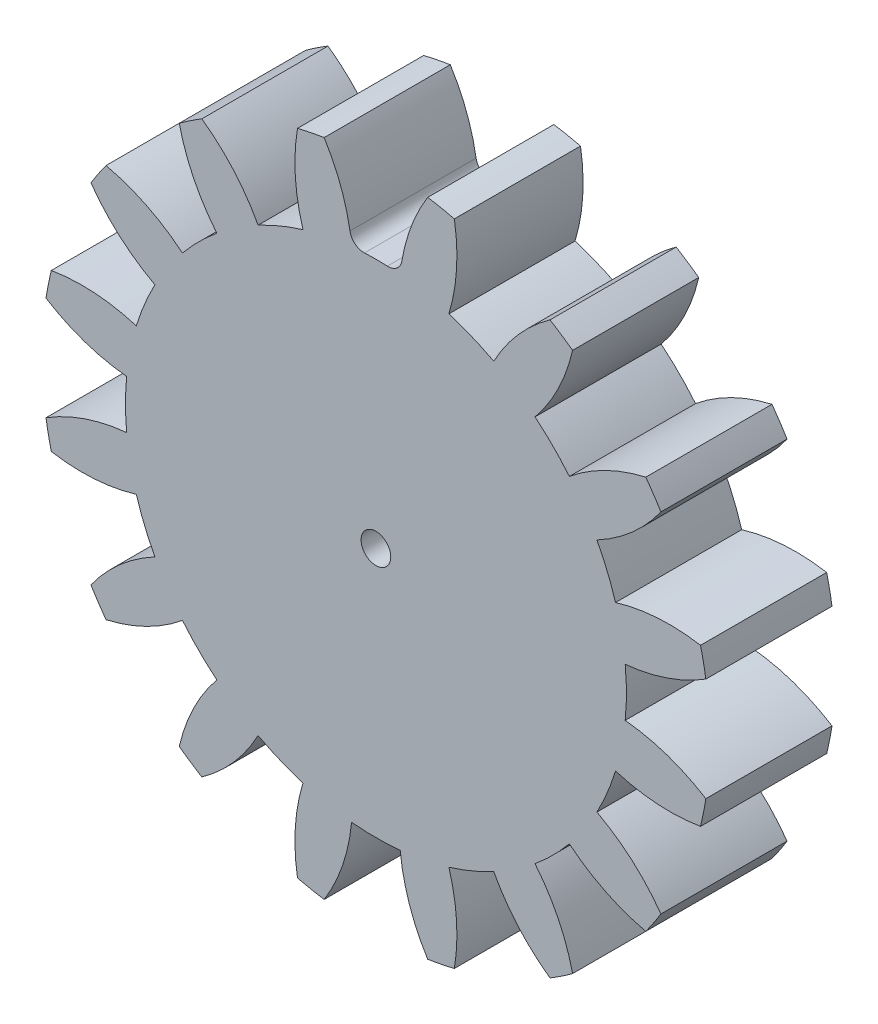
from build123d import *

# Parameters (mm, degrees)
SKETCH1_R           = 22.5
SKETCH1_R_2         = 1
BOSS_EXTRUDE1_DEPTH = 4.25
CUT_EXTRUDE1_DEPTH  = 33.102375302
FILLET1_R           = 0.95
CIRPATTERN3_COUNT   = 16


with BuildPart() as part:
    # Sketch1 → Boss-Extrude1 (new, symmetric)
    with BuildSketch(Plane.XY):
        Circle(SKETCH1_R)
        Circle(SKETCH1_R_2, mode=Mode.SUBTRACT)
    extrude(amount=BOSS_EXTRUDE1_DEPTH, both=True)

    # Sketch2 → Cut-Extrude1 (cut, symmetric)
    with BuildSketch(Plane.XY):
        with BuildLine():
            ThreePointArc((1.637057312, 16.795406168), (0, 16.875), (-1.637057312, 16.795406168))
            ThreePointArc((-1.637057312, 16.795406168), (-2.247114369, 19.619173601), (-3.48804499, 22.227990061))
            ThreePointArc((-3.48804499, 22.227990061), (0, 22.5), (3.48804499, 22.227990061))
            ThreePointArc((3.48804499, 22.227990061), (2.247114369, 19.619173601), (1.637057312, 16.795406168))
        make_face()
    cut_extrude1 = extrude(amount=CUT_EXTRUDE1_DEPTH, both=True, mode=Mode.SUBTRACT)

    # Fillet1
    fillet1_edges = [part.edges().sort_by_distance(p)[0] for p in [
        (1.637057312, 16.795406168, 0),
        (-1.637057312, 16.795406168, 0),
    ]]
    fillet(fillet1_edges, radius=FILLET1_R)

    # CirPattern3: Cut-Extrude1 ×16 about axis
    cirpattern3_axis = Axis((0, 0, 4.25), (0, 0, -1))
    for i in range(1, CIRPATTERN3_COUNT):
        add(cut_extrude1.rotate(cirpattern3_axis, i * 360 / CIRPATTERN3_COUNT), mode=Mode.SUBTRACT)


solid = part.part
